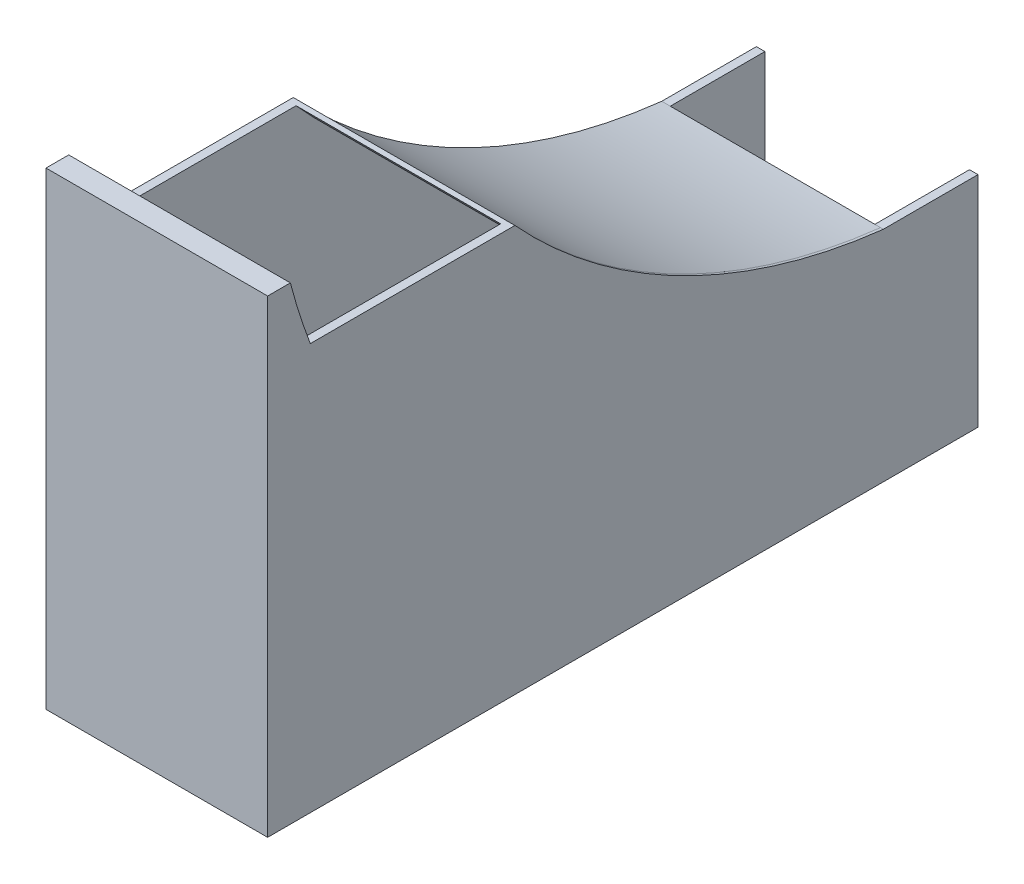
from build123d import *

# Parameters (mm, degrees)
ESQUISSE1_W                  = 78
ESQUISSE1_H                  = 165
BOSS_EXTRU_1_DEPTH           = 250
ENL_V_MAT_EXTRU_1_DEPTH      = 285.020723146
ENL_V_MAT_EXTRU_1_DEPTH_BACK = 78
BOSS_EXTRU_4_START           = 17.177257831
BOSS_EXTRU_4_DEPTH           = 3
BOSS_EXTRU_5_START           = -3
BOSS_EXTRU_5_DEPTH           = 3
BOSS_EXTRU_9_START           = 74
BOSS_EXTRU_9_DEPTH           = 74


# Read off the part's stored shape, not the designer's step: Boss.-Extru.4
with BuildPart() as part:
    # Esquisse1 → Boss.-Extru.1 (new body)
    with BuildSketch(Plane.XY):
        with Locations((-18.822742169, 27.426207869)):
            Rectangle(ESQUISSE1_W, ESQUISSE1_H)
    extrude(amount=BOSS_EXTRU_1_DEPTH)

    # Esquisse2 → Enlèv. mat.-Extru.1 (cut, two sides: drawn at the far end of the back side and taken through both)
    with BuildSketch(Plane.ZY.offset(57.822742169).offset(-ENL_V_MAT_EXTRU_1_DEPTH_BACK)):
        with BuildLine():
            Line((0, -664.156424161), (0, -55.073792131))
            Line((0, -55.073792131), (0, -50.073792131))
            Line((0, -50.073792131), (35, -50.073792131))
            ThreePointArc((35, -50.073792131), (165.813798966, -5.411019544), (242, 109.926207869))
            Line((242, 109.926207869), (395.487506317, 699.35240176))
            Line((395.487506317, 699.35240176), (-774.457853053, 1038.696573142))
            Line((-774.457853053, 1038.696573142), (-1169.94535937, -324.812252779))
            Line((-1169.94535937, -324.812252779), (0, -664.156424161))
        make_face()
    extrude(amount=ENL_V_MAT_EXTRU_1_DEPTH + ENL_V_MAT_EXTRU_1_DEPTH_BACK, mode=Mode.SUBTRACT)

    # Boss.-Extru.4 outline → Boss.-Extru.4 (add)
    with BuildSketch(Plane.YZ.offset(BOSS_EXTRU_4_START)):
        with BuildLine():
            Line((-50.073792131, 0), (21.926207869, 0))
            Line((21.926207869, 0), (21.926207869, 33.303690661))
            ThreePointArc((21.926207869, 33.303690661), (43.150814353, 104.129560556), (87.912843237, 162.978082516))
            Line((87.912843237, 162.978082516), (87.912843237, 234.978082516))
            ThreePointArc((87.912843237, 234.978082516), (-12.229352313, 156.482040882), (-50.073792131, 35))
            Line((-50.073792131, 35), (-50.073792131, 0))
        make_face()
    extrude(amount=BOSS_EXTRU_4_DEPTH)

    # Esquisse7 → Boss.-Extru.5 (add)
    with BuildSketch(Plane.ZY.offset(57.822742169).offset(BOSS_EXTRU_5_START)):
        with BuildLine():
            Line((0, -50.073792131), (0, 21.926207869))
            Line((0, 21.926207869), (33.3, 21.926207869))
            ThreePointArc((33.3, 21.926207869), (104.127859837, 43.15019521), (162.978082516, 87.912843237))
            Line((162.978082516, 87.912843237), (234.978082516, 87.912843237))
            ThreePointArc((234.978082516, 87.912843237), (156.482040881, -12.229352313), (35, -50.073792131))
            Line((35, -50.073792131), (0, -50.073792131))
        make_face()
    extrude(amount=BOSS_EXTRU_5_DEPTH)

    # Esquisse22 → Boss.-Extru.9 (add)
    with BuildSketch(Plane(origin=(-54.822742169, 0, 0), x_dir=(0, 0, -1), z_dir=(1, 0, 0)).offset(BOSS_EXTRU_9_START)):
        with BuildLine():
            Line((-33.3, 21.926207869), (-33.3, 19.926207869))
            ThreePointArc((-33.3, 19.926207869), (-105.482114961, 41.634114192), (-164.978082516, 87.912843237))
            Line((-164.978082516, 87.912843237), (-162.978082516, 87.912843237))
            ThreePointArc((-162.978082516, 87.912843237), (-104.127859837, 43.15019521), (-33.3, 21.926207869))
        make_face()
    extrude(amount=-BOSS_EXTRU_9_DEPTH)


solid = part.part
